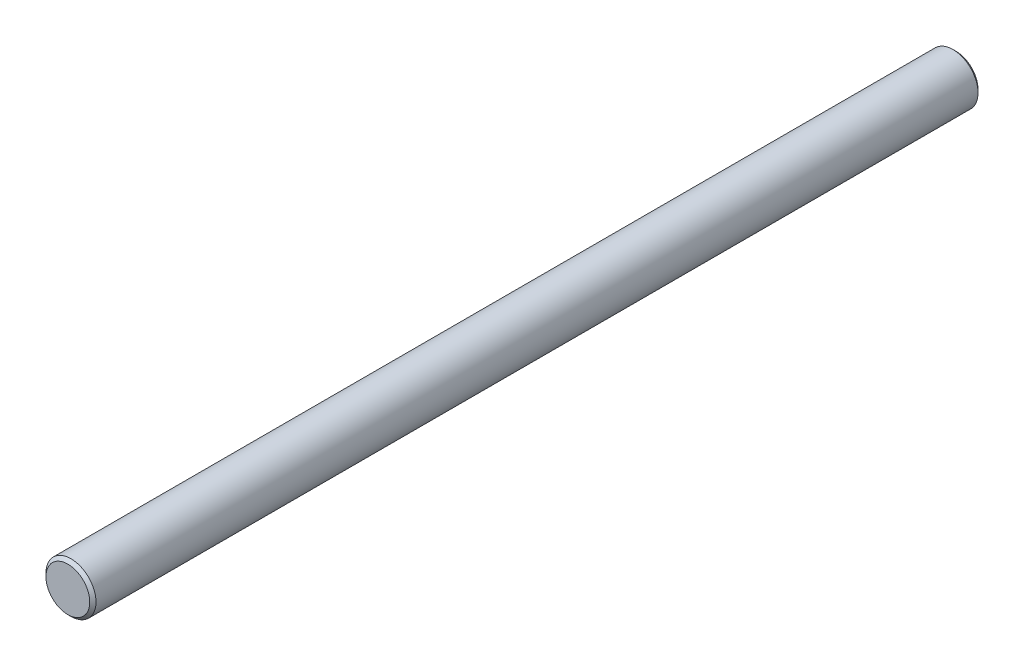
from build123d import *

# Parameters (mm, degrees)
SKETCH1_R           = 4
BOSS_EXTRUDE1_DEPTH = 71
CHAMFER1_SIZE       = 0.5


with BuildPart() as part:
    # Sketch1 → Boss-Extrude1 (new, symmetric)
    with BuildSketch(Plane.XY):
        Circle(SKETCH1_R)
    extrude(amount=BOSS_EXTRUDE1_DEPTH, both=True)

    # Chamfer1
    chamfer1_edges = [part.edges().sort_by_distance(p)[0] for p in [
        (-4, 0, -71),
        (-4, 0, 71),
    ]]
    chamfer(chamfer1_edges, length=CHAMFER1_SIZE)


solid = part.part
